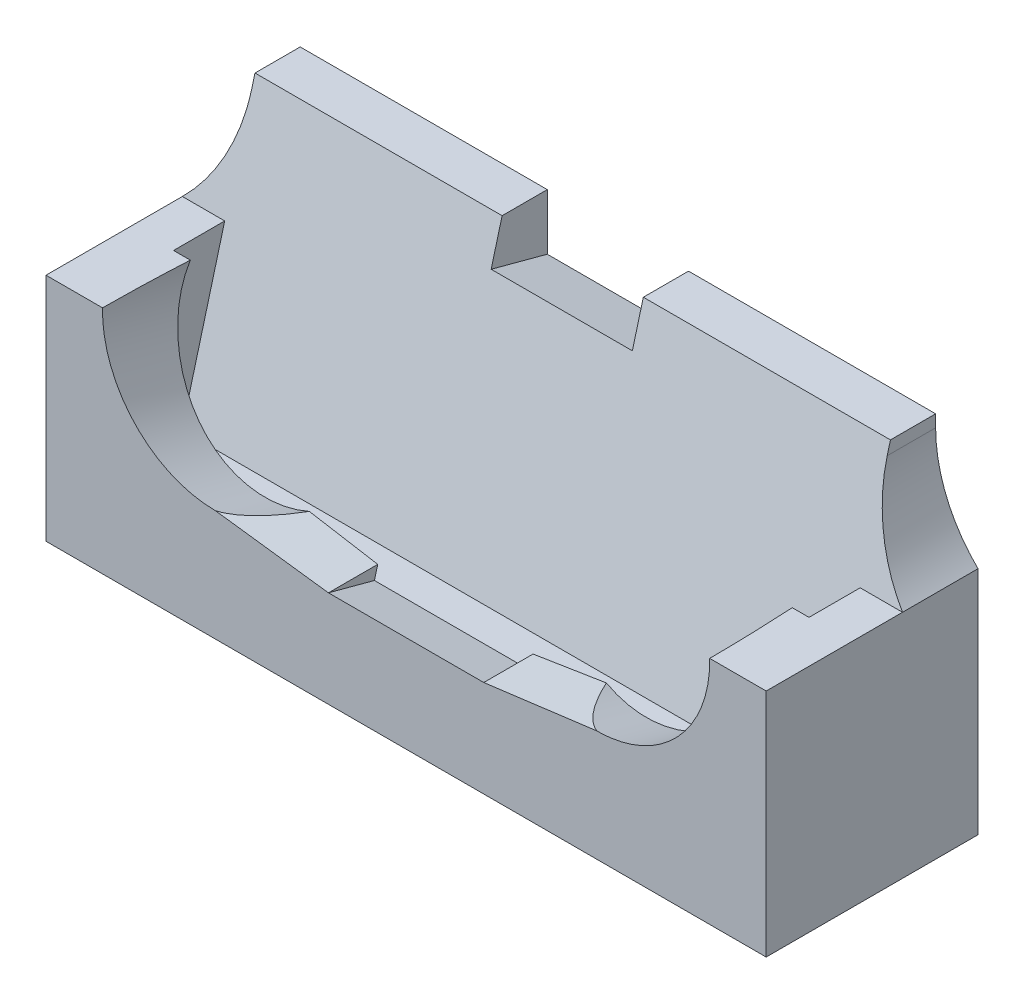
from build123d import *

# Parameters (mm, degrees)
SKETCH1_W           = 45
SKETCH1_H           = 15
BOSS_EXTRUDE1_DEPTH = 5
BOSS_EXTRUDE2_DEPTH = 45
SKETCH5_R           = 8
CUT_EXTRUDE1_DEPTH  = 10
CUT_EXTRUDE2_REACH  = 39.075
SKETCH6_W           = 45
SKETCH6_H           = 8
SKETCH7_W           = 11
SKETCH7_H           = 10.717790556
CUT_EXTRUDE4_DEPTH  = 6.5
CUT_EXTRUDE5_REACH  = 39.075
SKETCH10_W          = 15
SKETCH10_H          = 16.318516526
BOSS_EXTRUDE3_DEPTH = 3
SKETCH11_W          = 15
SKETCH11_H          = 16.318516526
BOSS_EXTRUDE4_DEPTH = 3
SKETCH12_W          = 10
SKETCH12_H          = 7.679226714
CUT_EXTRUDE6_DEPTH  = 6
FILLET1_R           = 10


with BuildPart() as part:
    # Sketch1 → Boss-Extrude1 (new body)
    with BuildSketch(Plane(origin=(0, 0, 0), x_dir=(1, 0, 0), z_dir=(0, 1, 0))):
        with Locations((1.125, 2.045454545)):
            Rectangle(SKETCH1_W, SKETCH1_H)
    extrude(amount=BOSS_EXTRUDE1_DEPTH)

    # Sketch2 → Boss-Extrude2 (add)
    with BuildSketch(Plane(origin=(23.625, 0, 0), x_dir=(0, 0, -1), z_dir=(1, 0, 0))):
        Polygon((-2.454545455, 5), (2.721835448, 24.318516526), (-5.454545455, 24.318516526), (-5.454545455, 5), align=None)
        Polygon((1.168921177, 5), (6.345302079, 24.318516526), (9.545454545, 24.318516526), (9.545454545, 5), align=None)
    extrude(amount=-BOSS_EXTRUDE2_DEPTH)

    # Sketch5 → Cut-Extrude1 (cut)
    with BuildSketch(Plane(origin=(0, 0.948572854, 3.540122086), x_dir=(-1, 0, 0), z_dir=(0, -0.2588190451025247, -0.9659258262890673))):
        with Locations(Location((12.375, 14.194346021, 0), (0, 0, 90))):
            Circle(SKETCH5_R)
        with Locations(Location((-14.625, 14.194346021, 0), (0, 0, 90))):
            Circle(SKETCH5_R)
    extrude(amount=-CUT_EXTRUDE1_DEPTH, mode=Mode.SUBTRACT)

    # Cut-Extrude2: up to this plane
    cut_extrude2_end = Plane(origin=(-21.375, 5, 2.454545455), z_dir=(0, -0.2588190451025246, -0.9659258262890673))
    # Sketch6 → Cut-Extrude2 (cut, up to the surface)
    with BuildSketch(Plane.XY.offset(5.454545455), mode=Mode.PRIVATE) as cut_extrude2_sk1:
        with Locations((1.125, 20.318516526)):
            Rectangle(SKETCH6_W, SKETCH6_H)
    cut_extrude2_tool1 = split(extrude(cut_extrude2_sk1.sketch, amount=-CUT_EXTRUDE2_REACH, mode=Mode.PRIVATE), bisect_by=cut_extrude2_end, keep=Keep.BOTH, mode=Mode.PRIVATE)
    add(cut_extrude2_tool1.solids().sort_by_distance((1.125, 20.318517, 5.454545))[0], mode=Mode.SUBTRACT)

    # Sketch7 → Cut-Extrude4 (cut)
    with BuildSketch(Plane(origin=(0, 0.948572854, 3.540122086), x_dir=(-1, 0, 0), z_dir=(0, -0.2588190451025247, -0.9659258262890673))):
        with Locations((-1.125, 10.553241299)):
            Rectangle(SKETCH7_W, SKETCH7_H)
    extrude(amount=-CUT_EXTRUDE4_DEPTH, mode=Mode.SUBTRACT)


with BuildPart() as cut_extrude4_piece_1:
    # of the separate pieces the step leaves, piece 1, a body of its own (cut_extrude4_pieces)
    add(part.part.solids().sort_by_distance((-21.375, 0, -9.545454545))[0])


with BuildPart() as cut_extrude4_piece_2:
    # of the separate pieces the step leaves, piece 2, a body of its own (cut_extrude4_pieces)
    add(part.part.solids().sort_by_distance((-4.375, 16.318516526, -0.578241908))[0])


with BuildPart() as cut_extrude4_piece_3:
    # of the separate pieces the step leaves, piece 3, a body of its own (cut_extrude4_pieces)
    add(part.part.solids().sort_by_distance((6.811601533, 16.318516526, -0.578241908))[0])


with BuildPart() as cut_extrude5_tool:
    # Cut-Extrude5: up to this plane
    cut_extrude5_end = Plane(origin=(-21.375, 5, 2.454545455), z_dir=(0, -0.2588190451025246, -0.9659258262890673))
    # Sketch9 → Cut-Extrude5 (new, up to the surface)
    with BuildSketch(Plane.XY.offset(5.454545455), mode=Mode.PRIVATE) as cut_extrude5_sk1:
        Polygon((-12.375, 7.874399938), (-4.375, 6.839123758), (6.625, 6.839123758), (14.625, 7.874399938), (14.625, 17.142741254), (-12.375, 17.142741254), align=None)
    cut_extrude5_tool1 = split(extrude(cut_extrude5_sk1.sketch, amount=-CUT_EXTRUDE5_REACH, mode=Mode.PRIVATE), bisect_by=cut_extrude5_end, keep=Keep.BOTH, mode=Mode.PRIVATE)
    add(cut_extrude5_tool1.solids().sort_by_distance((1.125, 12.138424, 5.454545))[0])


with BuildPart() as cut_extrude4_piece_1_1:
    add(cut_extrude4_piece_1.part)

    # Cut-Extrude5: cut by cut_extrude5_tool
    add(cut_extrude5_tool.part, mode=Mode.SUBTRACT)

    # Sketch10 → Boss-Extrude3 (add)
    with BuildSketch(Plane.ZY.offset(21.375)):
        with Locations((-2.045454545, 8.159258263)):
            Rectangle(SKETCH10_W, SKETCH10_H)
    extrude(amount=BOSS_EXTRUDE3_DEPTH)

    # Sketch11 → Boss-Extrude4 (add)
    with BuildSketch(Plane(origin=(23.625, 0, 0), x_dir=(0, 0, -1), z_dir=(1, 0, 0))):
        with Locations((2.045454545, 8.159258263)):
            Rectangle(SKETCH11_W, SKETCH11_H)
    extrude(amount=BOSS_EXTRUDE4_DEPTH)

    # Sketch12 → Cut-Extrude6 (cut)
    with BuildSketch(Plane(origin=(0, 0.042706196, 0.159381694), x_dir=(1, 0, 0), z_dir=(0, 0.2588190451025247, 0.9659258262890673))):
        with Locations((1.125, 25.971781551)):
            Rectangle(SKETCH12_W, SKETCH12_H)
    extrude(amount=-CUT_EXTRUDE6_DEPTH, mode=Mode.SUBTRACT)

    # Fillet1
    # the kernel refuses this fillet: 10 mm, written as the material it adds along each edge
    with BuildSketch(Plane(origin=(-21.375, 16.318516526, 13.651862532), x_dir=(-1, 0, 0), z_dir=(0, 0, -1))) as fillet1_piece_1_section:
        with BuildLine():
            CenterArc((10, 7.141428429), FILLET1_R, 180, 45.572995999)
            Line((0, 7.141428429), (0, 0))
            Line((0, 0), (3, 0))
        make_face()
    fillet1_piece_1 = extrude(amount=23.197317077, mode=Mode.PRIVATE)
    fillet1_piece_1 = split(fillet1_piece_1, bisect_by=Plane(origin=(-22.137016454, 20.028758468, -5.195864872), z_dir=(0, -0.2588190451025247, -0.9659258262890673)), keep=Keep.TOP, mode=Mode.PRIVATE)
    add(fillet1_piece_1)
    with BuildSketch(Plane(origin=(23.625, 16.318516526, 13.651862532), x_dir=(1, 0, 0), z_dir=(0, 0, -1))) as fillet1_piece_2_section:
        with BuildLine():
            CenterArc((10, -7.141428429), FILLET1_R, 134.427004001, 45.572995999)
            Line((0, -7.141428429), (0, 0))
            Line((0, 0), (3, 0))
        make_face()
    fillet1_piece_2 = extrude(amount=23.197317077, mode=Mode.PRIVATE)
    fillet1_piece_2 = split(fillet1_piece_2, bisect_by=Plane(origin=(24.387016454, 20.028758468, -5.195864872), z_dir=(0, -0.2588190451025247, -0.9659258262890673)), keep=Keep.TOP, mode=Mode.PRIVATE)
    add(fillet1_piece_2)


with BuildPart() as cut_extrude4_piece_2_1:
    add(cut_extrude4_piece_2.part)

    # Cut-Extrude5: cut by cut_extrude5_tool
    add(cut_extrude5_tool.part, mode=Mode.SUBTRACT)


with BuildPart() as cut_extrude4_piece_3_1:
    add(cut_extrude4_piece_3.part)

    # Cut-Extrude5: cut by cut_extrude5_tool
    add(cut_extrude5_tool.part, mode=Mode.SUBTRACT)


solid = cut_extrude4_piece_1_1.part
